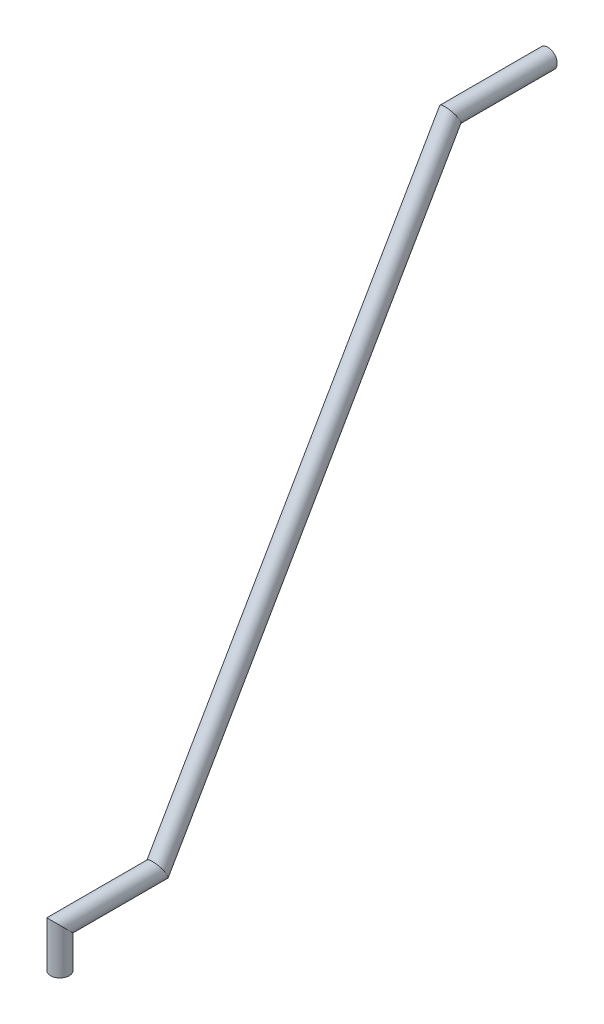
from build123d import *

# Parameters (mm, degrees)
SKETCH2_R   = 4.7625
SKETCH2_R_2 = 3.175


with BuildPart() as part:
    # Sweep2: sweep along a path in Sketch4
    with BuildLine(Plane(origin=(0, 0, 0), x_dir=(0, 0, -1), z_dir=(1, 0, 0))) as sweep2_path:
        Line((8, 0), (8, 20))
        Line((8, 20), (58, 20))
        Line((58, 20), (208, 279.807621135))
        Line((208, 279.807621135), (258, 279.807621135))
    # Sketch2 → Sweep2 (sweep)
    with BuildSketch(Plane(origin=(0, 0, 0), x_dir=(1, 0, 0), z_dir=(0, 1, 0))):
        with Locations((0, 8)):
            Circle(SKETCH2_R)
        with Locations((0, 8)):
            Circle(SKETCH2_R_2, mode=Mode.SUBTRACT)
    sweep(path=sweep2_path.line, transition=Transition.RIGHT)


solid = part.part
